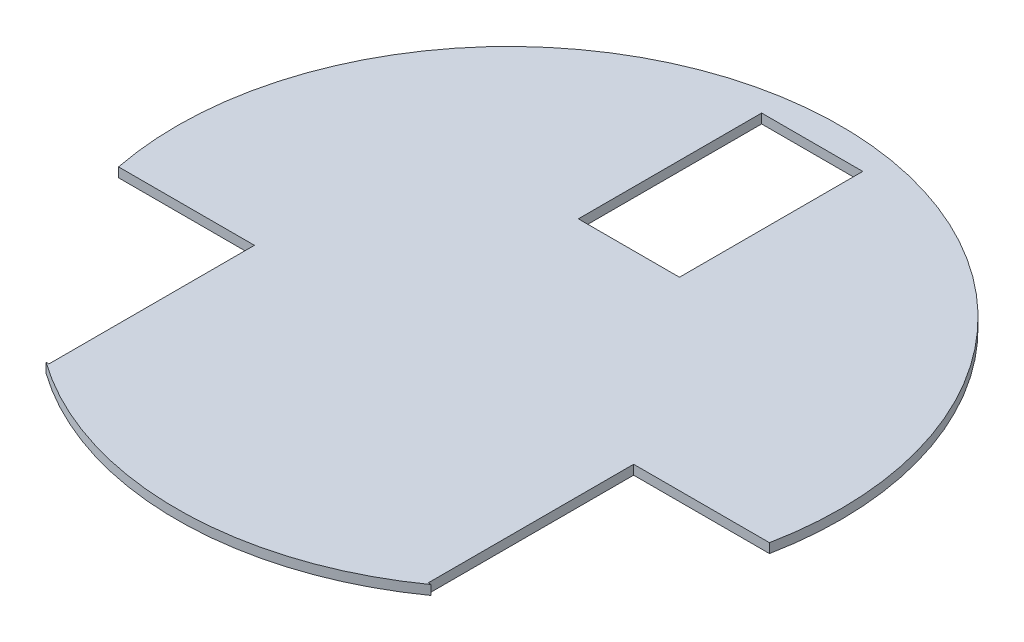
from build123d import *

# Parameters (mm, degrees)
SKETCH_1_R             = 105
EXTRUDE_360_DEPTH      = 3
CUT_EXTRUDE_801_DEPTH  = 149.522725534
SKETCH_6_W             = 32
SKETCH_6_H             = 58
CUT_EXTRUDE_1021_DEPTH = 149.522725534


with BuildPart() as part:
    # 草图1 → Extrude 360 (new body)
    with BuildSketch(Plane(origin=(0, 0, 0), x_dir=(1, 0, 0), z_dir=(0, 1, 0))):
        Circle(SKETCH_1_R)
    extrude(amount=EXTRUDE_360_DEPTH)

    # 草图5 → Cut-Extrude 801 (cut, through all)
    with BuildSketch(Plane(origin=(0, 3, 0), x_dir=(1, 0, 0), z_dir=(0, 1, 0))):
        with BuildLine():
            Line((-60, -20.5), (-102.979366865, -20.5))
            ThreePointArc((-102.979366865, -20.5), (-88.172313056, -57.014412304), (-60.948748962, -85.5))
            Line((-60.948748962, -85.5), (-60, -85.5))
            Line((-60, -85.5), (-60, -20.5))
        make_face()
        with BuildLine():
            ThreePointArc((60.948748962, -85.5), (88.172313056, -57.014412304), (102.979366865, -20.5))
            Line((102.979366865, -20.5), (60, -20.5))
            Line((60, -20.5), (60, -85.5))
            Line((60, -85.5), (60.948748962, -85.5))
        make_face()
    extrude(amount=-CUT_EXTRUDE_801_DEPTH, mode=Mode.SUBTRACT)

    # 草图6 → Cut-Extrude 1021 (cut, through all)
    with BuildSketch(Plane(origin=(0, 3, 0), x_dir=(1, 0, 0), z_dir=(0, 1, 0))):
        with Locations((0, 67)):
            Rectangle(SKETCH_6_W, SKETCH_6_H)
    extrude(amount=-CUT_EXTRUDE_1021_DEPTH, mode=Mode.SUBTRACT)


solid = part.part
